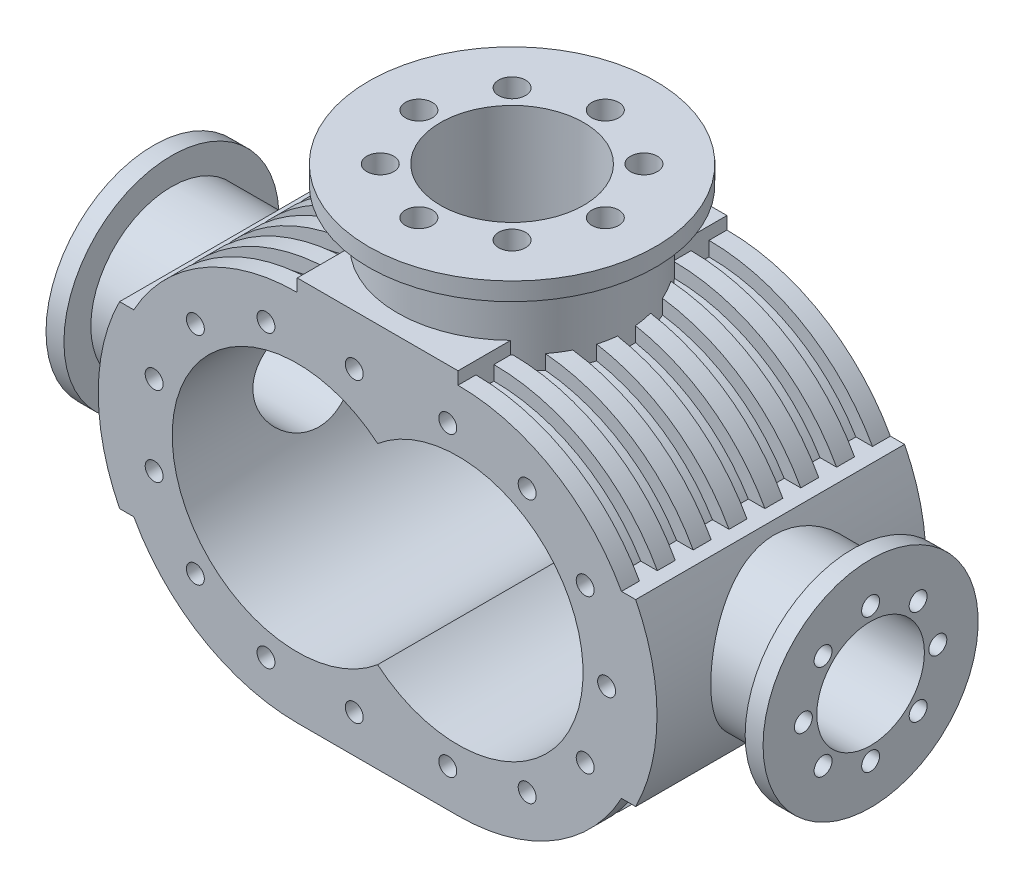
from build123d import *

# Parameters (mm, degrees)
BOSS_EXTRUDE1_DEPTH      = 150
CUT_EXTRUDE1_DEPTH       = 140
SKETCH3_R                = 10
CUT_EXTRUDE2_DEPTH       = 140
SKETCH4_R                = 5
CUT_EXTRUDE3_DEPTH       = 30
CRVPATTERN1_START        = -30
CRVPATTERN1_OUTLINE_R    = 5
CRVPATTERN1_DEPTH        = 30
SKETCH5_W                = 89.69
SKETCH5_H                = 15
BOSS_EXTRUDE2_DEPTH      = 150
BOSS_EXTRUDE4_START      = -16.930411
SKETCH6_R                = 64
SKETCH6_R_2              = 40
BOSS_EXTRUDE4_DEPTH      = 46.930411
CUT_EXTRUDE4_REACH       = 327.001
SKETCH7_R                = 40
BOSS_EXTRUDE5_START      = 10
SKETCH8_R                = 80
SKETCH8_R_2              = 40
BOSS_EXTRUDE5_DEPTH      = 10
SKETCH9_R                = 7.5
CUT_EXTRUDE5_DEPTH       = 40
CIRPATTERN1_COUNT        = 8
BOSS_EXTRUDE8_REACH      = 418.475
BOSS_EXTRUDE8_END_RADIUS = 111
SKETCH12_R               = 45
SKETCH12_R_2             = 30
SKETCH12_8_R             = 60
SKETCH12_8_R_2           = 45
BOSS_EXTRUDE9_DEPTH      = 10
CUT_EXTRUDE6_REACH       = 418.475
SKETCH12_9_R             = 30
SKETCH14_R               = 5
CUT_EXTRUDE7_DEPTH       = 30
CIRPATTERN2_COUNT        = 8
MIRROR1_COPY_1_SKETCH_R  = 5
MIRROR1_COPY_1_DEPTH     = 30
MIRROR1_COPY_2_SKETCH_R  = 5
MIRROR1_COPY_2_DEPTH     = 30
MIRROR1_COPY_3_SKETCH_R  = 5
MIRROR1_COPY_3_DEPTH     = 30
MIRROR1_COPY_4_SKETCH_R  = 5
MIRROR1_COPY_4_DEPTH     = 30
MIRROR1_COPY_5_SKETCH_R  = 5
MIRROR1_COPY_5_DEPTH     = 30
MIRROR1_COPY_6_SKETCH_R  = 5
MIRROR1_COPY_6_DEPTH     = 30
MIRROR1_COPY_7_SKETCH_R  = 5
MIRROR1_COPY_7_DEPTH     = 30
CUT_EXTRUDE8_REACH       = 456.781
SKETCH15_R               = 30
BOSS_EXTRUDE10_DEPTH     = 10
LPATTERN1_COUNT          = 8
LPATTERN1_PITCH          = 20


# Read off the part's stored shape, not the designer's step: CrvPattern1
with BuildPart() as part:
    # Sketch1 → Boss-Extrude1 (new body)
    with BuildSketch(Plane.XY):
        with BuildLine():
            Line((0, 96), (89.69, 96))
            ThreePointArc((89.69, 96), (185.69, 0), (89.69, -96))
            Line((89.69, -96), (0, -96))
            ThreePointArc((0, -96), (-96, 0), (0, 96))
        make_face()
    extrude(amount=-BOSS_EXTRUDE1_DEPTH)

    # Sketch2 → Cut-Extrude1 (cut)
    with BuildSketch(Plane.XY):
        with BuildLine():
            ThreePointArc((44.845, 53.422733691), (-69.75, 0), (44.845, -53.422733691))
            ThreePointArc((44.845, -53.422733691), (159.44, 0), (44.845, 53.422733691))
        make_face()
    extrude(amount=-CUT_EXTRUDE1_DEPTH, mode=Mode.SUBTRACT)

    # Sketch3 → Cut-Extrude2 (cut)
    with BuildSketch(Plane.XY.offset(-140)):
        Circle(SKETCH3_R)
        with Locations((89.69, 0)):
            Circle(SKETCH3_R)
    extrude(amount=-CUT_EXTRUDE2_DEPTH, mode=Mode.SUBTRACT)

    # Sketch4 → Cut-Extrude3 (cut)
    with BuildSketch(Plane.XY):
        with Locations((172.565, 0)):
            Circle(SKETCH4_R)
    extrude(amount=-CUT_EXTRUDE3_DEPTH, mode=Mode.SUBTRACT)

    # CrvPattern1 outline → CrvPattern1 (cut)
    with BuildSketch(Plane.XY.offset(CRVPATTERN1_START)):
        with Locations((160.625248894, 42.853892348)):
            Circle(CRVPATTERN1_OUTLINE_R)
        with Locations((160.625248894, -42.853892348)):
            Circle(CRVPATTERN1_OUTLINE_R)
        with Locations((128.24630101, -73.359916013)):
            Circle(CRVPATTERN1_OUTLINE_R)
        with Locations((83.973289474, -82.875)):
            Circle(CRVPATTERN1_OUTLINE_R)
        with Locations((31.802236842, -82.875)):
            Circle(CRVPATTERN1_OUTLINE_R)
        with Locations((-17.452379652, -81.01654195)):
            Circle(CRVPATTERN1_OUTLINE_R)
        with Locations((-56.830926836, -60.320074436)):
            Circle(CRVPATTERN1_OUTLINE_R)
        with Locations((-79.834279533, -22.243053668)):
            Circle(CRVPATTERN1_OUTLINE_R)
        with Locations((-79.834279533, 22.243053668)):
            Circle(CRVPATTERN1_OUTLINE_R)
        with Locations((-56.830926836, 60.320074436)):
            Circle(CRVPATTERN1_OUTLINE_R)
        with Locations((-17.452379652, 81.01654195)):
            Circle(CRVPATTERN1_OUTLINE_R)
        with Locations((31.802236842, 82.875)):
            Circle(CRVPATTERN1_OUTLINE_R)
        with Locations((83.973289474, 82.875)):
            Circle(CRVPATTERN1_OUTLINE_R)
        with Locations((128.24630101, 73.359916013)):
            Circle(CRVPATTERN1_OUTLINE_R)
    extrude(amount=CRVPATTERN1_DEPTH, mode=Mode.SUBTRACT)

    # Sketch5 → Boss-Extrude2 (add, through all)
    with BuildSketch(Plane.XY):
        with Locations((44.845, 103.5)):
            Rectangle(SKETCH5_W, SKETCH5_H)
        with BuildLine():
            Line((-99.100958623, -50), (-81.951204994, -50))
            ThreePointArc((-81.951204994, -50), (-96, 0), (-81.951204994, 50))
            Line((-81.951204994, 50), (-99.100958623, 50))
            ThreePointArc((-99.100958623, 50), (-111, 0), (-99.100958623, -50))
        make_face()
        with BuildLine():
            Line((171.641204994, 50), (188.790958623, 50))
            ThreePointArc((188.790958623, 50), (200.69, 0), (188.790958623, -50))
            Line((188.790958623, -50), (171.641204994, -50))
            ThreePointArc((171.641204994, -50), (185.69, 0), (171.641204994, 50))
        make_face()
    extrude(amount=-BOSS_EXTRUDE2_DEPTH)

    # Sketch6 → Boss-Extrude4 (add)
    with BuildSketch(Plane(origin=(0, 111, 0), x_dir=(1, 0, 0), z_dir=(0, 1, 0)).offset(BOSS_EXTRUDE4_START)):
        with Locations(Location((44.845, 75, 0), (0, 0, 45.516556927))):
            Circle(SKETCH6_R)
        with Locations(Location((44.845, 75, 0), (0, 0, 270))):
            Circle(SKETCH6_R_2, mode=Mode.SUBTRACT)
    extrude(amount=BOSS_EXTRUDE4_DEPTH)

    # Sketch7 → Cut-Extrude4 (cut, up to next)
    with BuildSketch(Plane(origin=(0, 111, 0), x_dir=(1, 0, 0), z_dir=(0, 1, 0)), mode=Mode.PRIVATE) as cut_extrude4_sk1:
        with Locations(Location((44.845, 75, 0), (0, 0, 270))):
            Circle(SKETCH7_R)
    cut_extrude4_tool1 = extrude(cut_extrude4_sk1.sketch, amount=-CUT_EXTRUDE4_REACH, mode=Mode.PRIVATE) & part.part
    add(cut_extrude4_tool1.solids().sort_by_distance((44.845, 111, -75))[0], mode=Mode.SUBTRACT)

    # Sketch8 → Boss-Extrude5 (add)
    with BuildSketch(Plane(origin=(0, 141, 0), x_dir=(1, 0, 0), z_dir=(0, 1, 0)).offset(BOSS_EXTRUDE5_START)):
        with Locations(Location((44.845, 75, 0), (0, 0, 270))):
            Circle(SKETCH8_R)
        with Locations(Location((44.845, 75, 0), (0, 0, 270))):
            Circle(SKETCH8_R_2, mode=Mode.SUBTRACT)
    extrude(amount=-BOSS_EXTRUDE5_DEPTH)

    # Sketch9 → Cut-Extrude5 (cut)
    with BuildSketch(Plane(origin=(0, 151, 0), x_dir=(1, 0, 0), z_dir=(0, 1, 0))):
        with Locations(Location((96.845, 75, 0), (0, 0, 270))):
            Circle(SKETCH9_R)
    cut_extrude5 = extrude(amount=-CUT_EXTRUDE5_DEPTH, mode=Mode.SUBTRACT)

    # CirPattern1: Cut-Extrude5 ×8 about axis
    cirpattern1_axis = Axis((44.845, 0, -75), (0, 1, 0))
    for i in range(1, CIRPATTERN1_COUNT):
        add(cut_extrude5.rotate(cirpattern1_axis, i * 360 / CIRPATTERN1_COUNT), mode=Mode.SUBTRACT)

    # Boss-Extrude8: up to this cylinder (the profile starts outside it)
    boss_extrude8_end = Plane(origin=(89.69, 0, -31.272792), z_dir=(0, 0, 1)) * Cylinder(BOSS_EXTRUDE8_END_RADIUS, 1059.95, mode=Mode.PRIVATE)
    # Sketch12 → Boss-Extrude8 (add, up to the surface)
    with BuildSketch(Plane.ZY.offset(-244.845), mode=Mode.PRIVATE) as boss_extrude8_sk1:
        with Locations(Location((-75, 0, 0), (0, 0, 180))):
            Circle(SKETCH12_R)
        with Locations(Location((-75, 0, 0), (0, 0, 180))):
            Circle(SKETCH12_R_2, mode=Mode.SUBTRACT)
    boss_extrude8_tool1 = extrude(boss_extrude8_sk1.sketch, amount=BOSS_EXTRUDE8_REACH, mode=Mode.PRIVATE) - boss_extrude8_end
    boss_extrude8 = boss_extrude8_tool1.solids().sort_by_distance((244.845, 0, -31.272792))[0]
    add(boss_extrude8)

    # Sketch12<8> → Boss-Extrude9 (add)
    with BuildSketch(Plane.ZY.offset(-244.845)):
        with Locations((-75, 0)):
            Circle(SKETCH12_8_R)
        with Locations(Location((-75, 0, 0), (0, 0, 180))):
            Circle(SKETCH12_8_R_2, mode=Mode.SUBTRACT)
    boss_extrude9 = extrude(amount=BOSS_EXTRUDE9_DEPTH)

    # Sketch12<9> → Cut-Extrude6 (cut, up to next)
    with BuildSketch(Plane.ZY.offset(-244.845), mode=Mode.PRIVATE) as cut_extrude6_sk1:
        with Locations(Location((-75, 0, 0), (0, 0, 180))):
            Circle(SKETCH12_9_R)
    cut_extrude6_tool1 = extrude(cut_extrude6_sk1.sketch, amount=CUT_EXTRUDE6_REACH, mode=Mode.PRIVATE) & part.part
    add(cut_extrude6_tool1.solids().sort_by_distance((244.845, 0, -75))[0], mode=Mode.SUBTRACT)

    # Sketch14 → Cut-Extrude7 (cut)
    with BuildSketch(Plane(origin=(244.845, 0, 0), x_dir=(0, 0, -1), z_dir=(1, 0, 0))):
        with Locations((112.5, 0)):
            Circle(SKETCH14_R)
    cut_extrude7 = extrude(amount=-CUT_EXTRUDE7_DEPTH, mode=Mode.SUBTRACT)

    # CirPattern2: Cut-Extrude7 ×8 about axis
    cirpattern2_axis = Axis((0, 0, -75), (1, 0, 0))
    for i in range(1, CIRPATTERN2_COUNT):
        add(cut_extrude7.rotate(cirpattern2_axis, i * 360 / CIRPATTERN2_COUNT), mode=Mode.SUBTRACT)

    # Mirror1: Boss-Extrude8, Boss-Extrude9, Cut-Extrude7 across plane
    add(boss_extrude8.mirror(Plane.ZY.offset(-44.845)))
    add(boss_extrude9.mirror(Plane.ZY.offset(-44.845)))
    add(cut_extrude7.mirror(Plane.ZY.offset(-44.845)), mode=Mode.SUBTRACT)

    # Mirror1 copy 1 sketch → Mirror1 copy 1 (cut)
    with BuildSketch(Plane(origin=(-155.155, -53.033008589, -21.966991411), x_dir=(0, 0.7071067811865475, -0.7071067811865476), z_dir=(-1, 0, 0))):
        with Locations((112.5, 0)):
            Circle(MIRROR1_COPY_1_SKETCH_R)
    extrude(amount=-MIRROR1_COPY_1_DEPTH, mode=Mode.SUBTRACT)

    # Mirror1 copy 2 sketch → Mirror1 copy 2 (cut)
    with BuildSketch(Plane(origin=(-155.155, -75, -75), x_dir=(0, 1, 0), z_dir=(-1, 0, 0))):
        with Locations((112.5, 0)):
            Circle(MIRROR1_COPY_2_SKETCH_R)
    extrude(amount=-MIRROR1_COPY_2_DEPTH, mode=Mode.SUBTRACT)

    # Mirror1 copy 3 sketch → Mirror1 copy 3 (cut)
    with BuildSketch(Plane(origin=(-155.155, -53.033008589, -128.033008589), x_dir=(0, 0.7071067811865476, 0.7071067811865475), z_dir=(-1, 0, 0))):
        with Locations((112.5, 0)):
            Circle(MIRROR1_COPY_3_SKETCH_R)
    extrude(amount=-MIRROR1_COPY_3_DEPTH, mode=Mode.SUBTRACT)

    # Mirror1 copy 4 sketch → Mirror1 copy 4 (cut)
    with BuildSketch(Plane(origin=(-155.155, 0, -150), x_dir=(0, 0, 1), z_dir=(-1, 0, 0))):
        with Locations((112.5, 0)):
            Circle(MIRROR1_COPY_4_SKETCH_R)
    extrude(amount=-MIRROR1_COPY_4_DEPTH, mode=Mode.SUBTRACT)

    # Mirror1 copy 5 sketch → Mirror1 copy 5 (cut)
    with BuildSketch(Plane(origin=(-155.155, 53.033008589, -128.033008589), x_dir=(0, -0.7071067811865475, 0.7071067811865477), z_dir=(-1, 0, 0))):
        with Locations((112.5, 0)):
            Circle(MIRROR1_COPY_5_SKETCH_R)
    extrude(amount=-MIRROR1_COPY_5_DEPTH, mode=Mode.SUBTRACT)

    # Mirror1 copy 6 sketch → Mirror1 copy 6 (cut)
    with BuildSketch(Plane(origin=(-155.155, 75, -75), x_dir=(0, -1, 0), z_dir=(-1, 0, 0))):
        with Locations((112.5, 0)):
            Circle(MIRROR1_COPY_6_SKETCH_R)
    extrude(amount=-MIRROR1_COPY_6_DEPTH, mode=Mode.SUBTRACT)

    # Mirror1 copy 7 sketch → Mirror1 copy 7 (cut)
    with BuildSketch(Plane(origin=(-155.155, 53.033008589, -21.966991411), x_dir=(0, -0.7071067811865477, -0.7071067811865474), z_dir=(-1, 0, 0))):
        with Locations((112.5, 0)):
            Circle(MIRROR1_COPY_7_SKETCH_R)
    extrude(amount=-MIRROR1_COPY_7_DEPTH, mode=Mode.SUBTRACT)

    # Sketch15 → Cut-Extrude8 (cut, up to next)
    with BuildSketch(Plane.ZY.offset(155.155), mode=Mode.PRIVATE) as cut_extrude8_sk1:
        with Locations(Location((-75, 0, 0), (0, 0, 180))):
            Circle(SKETCH15_R)
    cut_extrude8_tool1 = extrude(cut_extrude8_sk1.sketch, amount=-CUT_EXTRUDE8_REACH, mode=Mode.PRIVATE) & part.part
    add(cut_extrude8_tool1.solids().sort_by_distance((-155.155, 0, -75))[0], mode=Mode.SUBTRACT)

    # Sketch16 → Boss-Extrude10 (add)
    with BuildSketch(Plane.XY):
        with BuildLine():
            Line((89.69, 104), (89.69, 96))
            ThreePointArc((89.69, 96), (136.679360498, 83.713798146), (171.641204994, 50))
            Line((171.641204994, 50), (180.882104921, 50))
            ThreePointArc((180.882104921, 50), (142.680565198, 89.487429285), (89.69, 104))
        make_face()
        with BuildLine():
            ThreePointArc((-81.951204994, 50), (-46.989360498, 83.713798146), (0, 96))
            Line((0, 96), (0, 104))
            ThreePointArc((0, 104), (-52.990565198, 89.487429285), (-91.192104921, 50))
            Line((-91.192104921, 50), (-81.951204994, 50))
        make_face()
        with BuildLine():
            ThreePointArc((0, -96), (-46.989360498, -83.713798146), (-81.951204994, -50))
            Line((-81.951204994, -50), (-91.192104921, -50))
            ThreePointArc((-91.192104921, -50), (-52.990565198, -89.487429285), (0, -104))
            Line((0, -104), (89.69, -104))
            ThreePointArc((89.69, -104), (142.680565198, -89.487429285), (180.882104921, -50))
            Line((180.882104921, -50), (171.641204994, -50))
            ThreePointArc((171.641204994, -50), (136.679360498, -83.713798146), (89.69, -96))
            Line((89.69, -96), (0, -96))
        make_face()
    boss_extrude10 = extrude(amount=-BOSS_EXTRUDE10_DEPTH)

    # LPattern1: Boss-Extrude10 ×8
    with Locations(*[(0, 0, -i * LPATTERN1_PITCH) for i in range(1, LPATTERN1_COUNT)]):
        add(boss_extrude10)


solid = part.part
